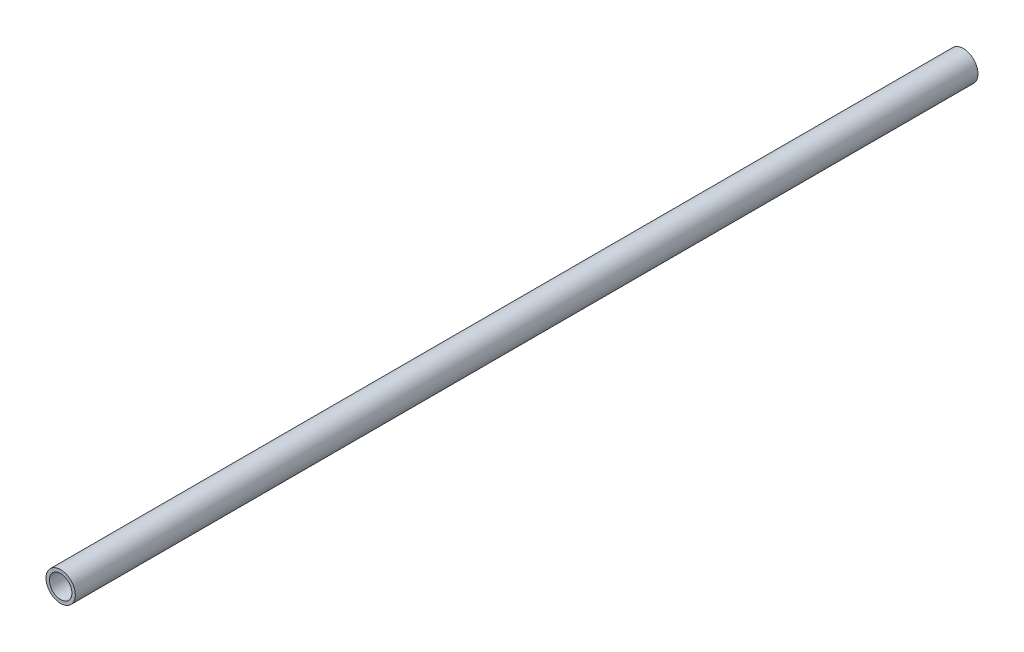
from build123d import *

# Parameters (mm, degrees)
SKETCH1_R           = 6.5
SKETCH1_R_2         = 5
BOSS_EXTRUDE1_DEPTH = 400


with BuildPart() as part:
    # Sketch1 → Boss-Extrude1 (new body)
    with BuildSketch(Plane.XY):
        with Locations((390.7614039, 31.081528881)):
            Circle(SKETCH1_R)
        with Locations((390.7614039, 31.081528881)):
            Circle(SKETCH1_R_2, mode=Mode.SUBTRACT)
    extrude(amount=BOSS_EXTRUDE1_DEPTH)


solid = part.part
